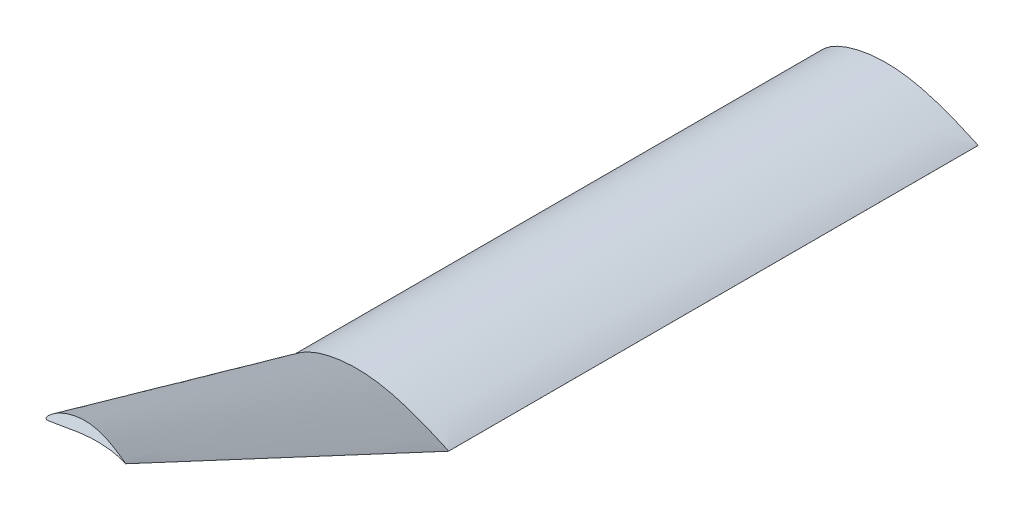
from build123d import *

# Parameters (mm, degrees)
SKETCH3_W           = 0.049362983
SKETCH3_H           = 0.049362982
SKETCH3_W_2         = 0.024681491
SKETCH3_H_2         = 0.024681492
SKETCH3_W_3         = 10
SKETCH3_H_3         = 10
SKETCH3_W_4         = 25
SKETCH3_H_4         = 25
BOSS_EXTRUDE1_DEPTH = 1000


with BuildPart() as part:
    # Sketch3 → Boss-Extrude1 (new body)
    with BuildSketch(Plane.XY):
        with BuildLine():
            Line((300, -0.018), (300, 0.015))
            add(Edge.make_bspline(
                [(300, 0.015), (299.754862186, 0.180319889), (298.848516045, 0.791555834), (296.905820396, 1.940844568), (293.846562551, 3.498119544), (289.786234956, 5.300647852), (284.81091618, 7.500970658), (278.896848113, 10.093160122), (269.235368374, 14.194181818), (258.498402845, 18.648777598), (246.758684368, 23.271603755), (237.010230395, 26.912833416), (226.749735844, 30.509867692), (212.356834838, 35.163111397), (197.522529239, 39.334646313), (182.353227236, 42.798461581), (170.853201975, 44.98301139), (159.331591846, 46.690763421), (147.82017929, 47.910045372), (136.347845343, 48.609534928), (124.958548533, 48.807103238), (113.716248614, 48.48487275), (99.148579004, 47.416559044), (84.989197502, 45.420259799), (71.374633428, 42.547676381), (61.748056885, 40.039953084), (52.621081944, 37.189912681), (44.058254452, 34.007861761), (36.116375062, 30.544956582), (28.854851854, 26.849076748), (22.32185623, 23.005051099), (16.550332438, 19.127163233), (11.571972604, 15.305964816), (7.422406451, 11.604304991), (4.122660528, 8.102946267), (1.717759869, 4.901059517), (0.33947435, 2.239212474), (-0.102376723, 0.158251074), (0.204042896, -1.585802336), (1.733702046, -3.011834921), (4.269174327, -3.6752251), (7.579250506, -3.882881475), (11.724856181, -3.646902674), (16.683612166, -3.07277679), (22.442616665, -2.246016868), (28.969311466, -1.265628508), (36.224025164, -0.197810814), (44.15113532, 0.991081194), (52.70037548, 2.273175336), (65.16584294, 4.13422544), (78.267212303, 6.012200663), (99.339439731, 8.800524446), (117.653538429, 10.890740194), (140.156929362, 12.90538658), (159.291423122, 14.217617844), (178.46609452, 14.840725332), (193.73246988, 14.83951784), (205.000701033, 14.58328475), (216.02516098, 14.062603516), (226.716356783, 13.318832132), (236.983711091, 12.374806266), (246.740426253, 11.277147863), (255.896535959, 10.033042314), (264.364958316, 8.678761763), (272.059932476, 7.24351996), (278.903943991, 5.784295144), (284.834441266, 4.34978891), (289.798469557, 2.925803483), (293.795359277, 1.632851008), (296.845206134, 0.715459418), (298.816643013, 0.216945523), (299.753762754, 0.030888323), (300, -0.018)],
                knots=[0, 0, 0, 0, 0.001413477, 0.005226038, 0.010781091, 0.017815608, 0.026460951, 0.036790889, 0.048685593, 0.076639155, 0.092362872, 0.109003461, 0.126386903, 0.144339126, 0.181312719, 0.200023431, 0.218712626, 0.237261299, 0.255692478, 0.274037197, 0.292192583, 0.310132767, 0.327788163, 0.362001934, 0.378421226, 0.394286639, 0.40954344, 0.424114253, 0.43793778, 0.450941833, 0.463044023, 0.474154417, 0.484164575, 0.493023962, 0.500713088, 0.507125739, 0.512129705, 0.514904185, 0.517171427, 0.520261618, 0.5242453, 0.529497961, 0.536092185, 0.54406114, 0.553363127, 0.563904543, 0.575614949, 0.588420092, 0.60222661, 0.616944448, 0.648675826, 0.665501113, 0.718564132, 0.736789145, 0.773513212, 0.810244924, 0.828488569, 0.846493195, 0.864125178, 0.88124851, 0.897725282, 0.913415058, 0.928184346, 0.941897285, 0.954411455, 0.965602702, 0.975349728, 0.983575522, 0.990284579, 0.99543259, 0.998799869, 1, 1, 1, 1], degree=3))
        make_face()
        with Locations((0.205080965, 0.015770824)):
            Rectangle(SKETCH3_W, SKETCH3_H, mode=Mode.SUBTRACT)
        with Locations((0.476546058, 0.01181697)):
            Rectangle(SKETCH3_W_2, SKETCH3_H_2, mode=Mode.SUBTRACT)
        with Locations((177.950642805, 26.874787095)):
            Rectangle(SKETCH3_W_3, SKETCH3_H_3, mode=Mode.SUBTRACT)
        with Locations((82.780238575, 26.220217403)):
            Rectangle(SKETCH3_W_4, SKETCH3_H_4, mode=Mode.SUBTRACT)
    extrude(amount=BOSS_EXTRUDE1_DEPTH)

    # Sketch7 → Loft1 section 0
    with BuildSketch(Plane.XY.offset(1000)):
        with BuildLine():
            Line((300, -0.018), (300, 0.015))
            add(Edge.make_bspline(
                [(300, 0.015), (299.754862186, 0.180319889), (298.848516045, 0.791555834), (296.905820396, 1.940844568), (293.846562551, 3.498119544), (289.786234956, 5.300647852), (284.81091618, 7.500970658), (278.896848113, 10.093160122), (269.235368374, 14.194181818), (258.498402845, 18.648777598), (246.758684368, 23.271603755), (237.010230395, 26.912833416), (226.749735844, 30.509867692), (212.356834838, 35.163111397), (197.522529239, 39.334646313), (182.353227236, 42.798461581), (170.853201975, 44.98301139), (159.331591846, 46.690763421), (147.82017929, 47.910045372), (136.347845343, 48.609534928), (124.958548533, 48.807103238), (113.716248614, 48.48487275), (99.148579004, 47.416559044), (84.989197502, 45.420259799), (71.374633428, 42.547676381), (61.748056885, 40.039953084), (52.621081944, 37.189912681), (44.058254452, 34.007861761), (36.116375062, 30.544956582), (28.854851854, 26.849076748), (22.32185623, 23.005051099), (16.550332438, 19.127163233), (11.571972604, 15.305964816), (7.422406451, 11.604304991), (4.122660528, 8.102946267), (1.717759869, 4.901059517), (0.33947435, 2.239212474), (-0.102376723, 0.158251074), (0.204042896, -1.585802336), (1.733702046, -3.011834921), (4.269174327, -3.6752251), (7.579250506, -3.882881475), (11.724856181, -3.646902674), (16.683612166, -3.07277679), (22.442616665, -2.246016868), (28.969311466, -1.265628508), (36.224025164, -0.197810814), (44.15113532, 0.991081194), (52.70037548, 2.273175336), (65.16584294, 4.13422544), (78.267212303, 6.012200663), (99.339439731, 8.800524446), (117.653538429, 10.890740194), (140.156929362, 12.90538658), (159.291423122, 14.217617844), (178.46609452, 14.840725332), (193.73246988, 14.83951784), (205.000701033, 14.58328475), (216.02516098, 14.062603516), (226.716356783, 13.318832132), (236.983711091, 12.374806266), (246.740426253, 11.277147863), (255.896535959, 10.033042314), (264.364958316, 8.678761763), (272.059932476, 7.24351996), (278.903943991, 5.784295144), (284.834441266, 4.34978891), (289.798469557, 2.925803483), (293.795359277, 1.632851008), (296.845206134, 0.715459418), (298.816643013, 0.216945523), (299.753762754, 0.030888323), (300, -0.018)],
                knots=[0, 0, 0, 0, 0.001413477, 0.005226038, 0.010781091, 0.017815608, 0.026460951, 0.036790889, 0.048685593, 0.076639155, 0.092362872, 0.109003461, 0.126386903, 0.144339126, 0.181312719, 0.200023431, 0.218712626, 0.237261299, 0.255692478, 0.274037197, 0.292192583, 0.310132767, 0.327788163, 0.362001934, 0.378421226, 0.394286639, 0.40954344, 0.424114253, 0.43793778, 0.450941833, 0.463044023, 0.474154417, 0.484164575, 0.493023962, 0.500713088, 0.507125739, 0.512129705, 0.514904185, 0.517171427, 0.520261618, 0.5242453, 0.529497961, 0.536092185, 0.54406114, 0.553363127, 0.563904543, 0.575614949, 0.588420092, 0.60222661, 0.616944448, 0.648675826, 0.665501113, 0.718564132, 0.736789145, 0.773513212, 0.810244924, 0.828488569, 0.846493195, 0.864125178, 0.88124851, 0.897725282, 0.913415058, 0.928184346, 0.941897285, 0.954411455, 0.965602702, 0.975349728, 0.983575522, 0.990284579, 0.99543259, 0.998799869, 1, 1, 1, 1], degree=3))
        make_face()
    # Sketch6 → Loft1 section 1
    with BuildSketch(Plane(origin=(0, 306.004812296, 1600), x_dir=(1, 0, 0), z_dir=(0, 0.4226182617407004, 0.9063077870366495))):
        with BuildLine():
            Line((300, -23.766492632), (300, -23.749992593))
            add(Edge.make_bspline(
                [(300, -23.749992593), (299.877430803, -23.667332453), (299.424256661, -23.361713757), (298.452906538, -22.787068031), (296.923273997, -22.008428701), (294.893105396, -21.107162415), (292.405440123, -20.006998409), (289.448399094, -18.710900611), (284.617647796, -16.660384912), (279.249152331, -14.433081752), (273.379279206, -12.121663206), (268.505040688, -10.301044068), (263.374781276, -8.502522675), (256.178313748, -6.175895319), (248.761143401, -4.090122926), (241.176474456, -2.358211195), (235.426448222, -1.265933706), (229.665629529, -0.41205567), (223.909909634, 0.197586747), (218.17372909, 0.547332353), (212.479067213, 0.646116742), (206.857903955, 0.485001117), (199.574051918, -0.049157), (192.494344419, -1.047308984), (185.687046277, -2.483604091), (180.873746618, -3.737468706), (176.310248352, -5.162492279), (172.028824477, -6.753521503), (168.057875388, -8.484978189), (164.427105194, -10.332922477), (161.160599654, -12.254939849), (158.274830931, -14.193888369), (155.785645125, -16.104492098), (153.710857141, -17.955326388), (152.060980275, -19.706009892), (150.858527101, -21.306957055), (150.169382712, -22.637883725), (149.948456652, -23.678366886), (150.101666824, -24.550395655), (150.866498209, -25.263413634), (152.134237349, -25.595109508), (153.789279354, -25.698937941), (155.862087094, -25.580948262), (158.341470953, -25.29388464), (161.220980014, -24.880503702), (164.484335136, -24.390308362), (168.111700566, -23.856398252), (172.075265021, -23.261950842), (176.349895213, -22.620902254), (182.582643689, -21.690375), (189.133343867, -20.751385168), (199.669482508, -19.357219978), (208.82655352, -18.312109631), (220.078275605, -17.304784055), (229.645545119, -16.648666871), (239.232903499, -16.33711239), (246.866109238, -16.337716137), (252.500238143, -16.465832985), (258.012481158, -16.726174218), (263.358091706, -17.09806079), (268.491781005, -17.570074839), (273.370150127, -18.11890534), (277.94821581, -18.740959586), (282.182437006, -19.418101463), (286.029933188, -20.135724062), (289.451947041, -20.865338196), (292.417202694, -21.582593011), (294.899222711, -22.294587408), (296.897672299, -22.941065175), (298.422599335, -23.399762055), (299.408320107, -23.649019592), (299.876881086, -23.742048413), (300, -23.766492632)],
                knots=[0, 0, 0, 0, 0.001413477, 0.005226038, 0.010781091, 0.017815608, 0.026460951, 0.036790889, 0.048685593, 0.076639155, 0.092362872, 0.109003461, 0.126386903, 0.144339126, 0.181312719, 0.200023431, 0.218712626, 0.237261299, 0.255692478, 0.274037197, 0.292192583, 0.310132767, 0.327788163, 0.362001934, 0.378421226, 0.394286639, 0.40954344, 0.424114253, 0.43793778, 0.450941833, 0.463044023, 0.474154417, 0.484164575, 0.493023962, 0.500713088, 0.507125739, 0.512129705, 0.514904185, 0.517171427, 0.520261618, 0.5242453, 0.529497961, 0.536092185, 0.54406114, 0.553363127, 0.563904543, 0.575614949, 0.588420092, 0.60222661, 0.616944448, 0.648675826, 0.665501113, 0.718564132, 0.736789145, 0.773513212, 0.810244924, 0.828488569, 0.846493195, 0.864125178, 0.88124851, 0.897725282, 0.913415058, 0.928184346, 0.941897285, 0.954411455, 0.965602702, 0.975349728, 0.983575522, 0.990284579, 0.99543259, 0.998799869, 1, 1, 1, 1], degree=3))
        make_face()
    loft()


solid = part.part
